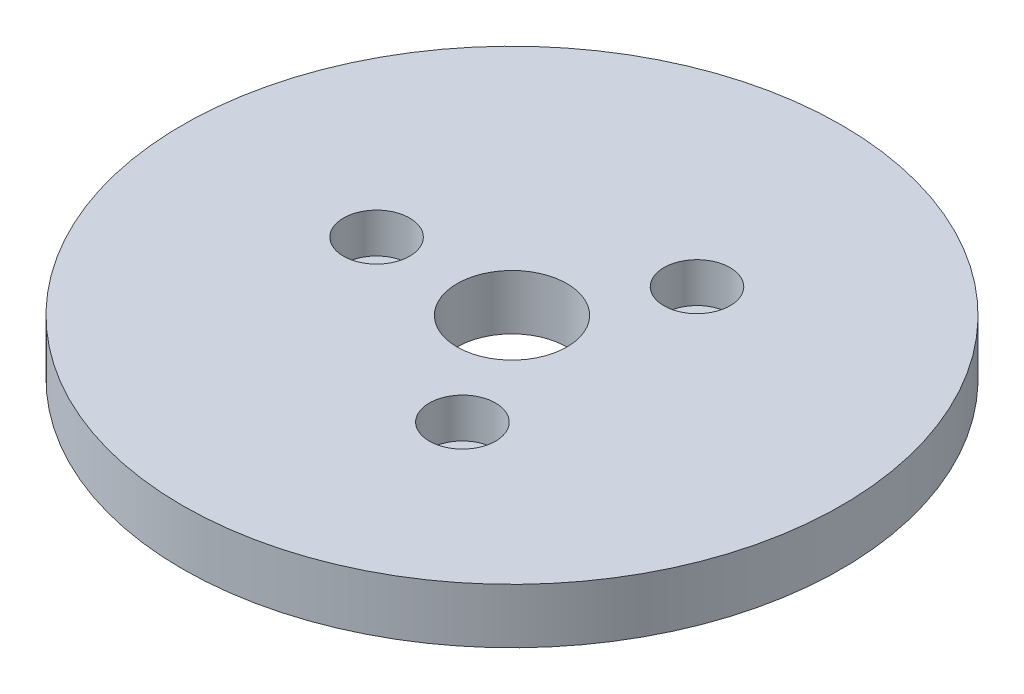
from build123d import *

# Parameters (mm, degrees)
SKETCH1_R           = 60
BOSS_EXTRUDE1_DEPTH = 10
SKETCH2_R           = 10
CUT_EXTRUDE1_DEPTH  = 86.440037453
SKETCH3_R           = 6.027007647
CUT_EXTRUDE2_DEPTH  = 7.23954988
CIRPATTERN1_COUNT   = 3


with BuildPart() as part:
    # Sketch1 → Boss-Extrude1 (new body)
    with BuildSketch(Plane(origin=(0, 0, 0), x_dir=(1, 0, 0), z_dir=(0, 1, 0))):
        Circle(SKETCH1_R)
    extrude(amount=BOSS_EXTRUDE1_DEPTH)

    # Sketch2 → Cut-Extrude1 (cut, through all)
    with BuildSketch(Plane(origin=(0, 0, 0), x_dir=(1, 0, 0), z_dir=(0, 1, 0))):
        Circle(SKETCH2_R)
    extrude(amount=CUT_EXTRUDE1_DEPTH, mode=Mode.SUBTRACT)

    # Sketch3 → Cut-Extrude2 (cut)
    with BuildSketch(Plane(origin=(0, 10, 0), x_dir=(1, 0, 0), z_dir=(0, 1, 0))):
        with Locations((-24.655172304, 0)):
            Circle(SKETCH3_R)
    cut_extrude2 = extrude(amount=-CUT_EXTRUDE2_DEPTH, mode=Mode.SUBTRACT)

    # CirPattern1: Cut-Extrude2 ×3 about axis
    cirpattern1_axis = Axis((0, 0, 0), (0, 1, 0))
    for i in range(1, CIRPATTERN1_COUNT):
        add(cut_extrude2.rotate(cirpattern1_axis, i * 360 / CIRPATTERN1_COUNT), mode=Mode.SUBTRACT)


solid = part.part
